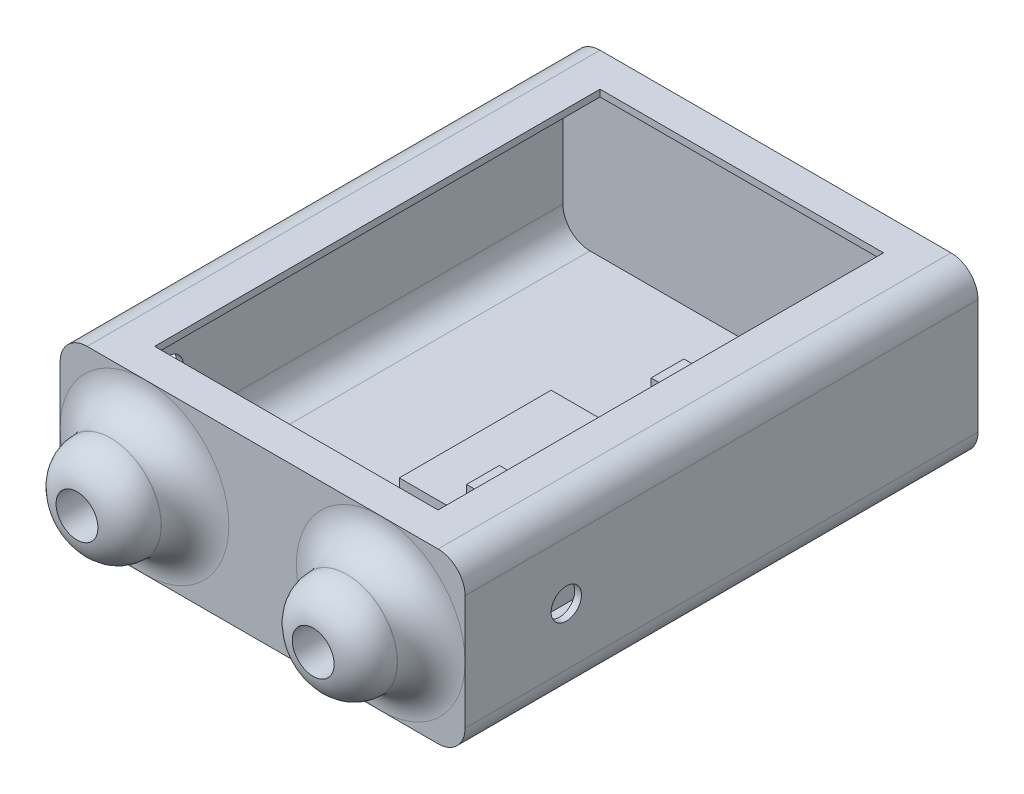
from build123d import *

# Parameters (mm, degrees)
SKETCH1_W           = 60
SKETCH1_H           = 25
BOSS_EXTRUDE1_DEPTH = 1
SKETCH2_W           = 60
SKETCH2_H           = 25
SKETCH2_W_2         = 58
SKETCH2_H_2         = 23
BOSS_EXTRUDE2_DEPTH = 75
FILLET2_R           = 4
SKETCH4_R           = 7.5
SKETCH4_R_2         = 3.1
BOSS_EXTRUDE3_DEPTH = 10
FILLET3_R           = 5
SKETCH18_R          = 2
CUT_EXTRUDE6_DEPTH  = 1
SKETCH5_R           = 2.25
CUT_EXTRUDE1_DEPTH  = 98.63324229
SKETCH10_W          = 22.476776695
SKETCH10_H          = 22.501776695
BOSS_EXTRUDE4_DEPTH = 6
SKETCH12_W          = 2.5
SKETCH12_H          = 4.858493649
BOSS_EXTRUDE5_DEPTH = 15
SKETCH13_R          = 1.35
CUT_EXTRUDE3_DEPTH  = 12
SKETCH19_W          = 42
SKETCH19_H          = 66
CUT_EXTRUDE7_DEPTH  = 1
BOSS_EXTRUDE7_DEPTH = 2.5


with BuildPart() as part:
    # Sketch1 → Boss-Extrude1 (new body)
    with BuildSketch(Plane.XY):
        Rectangle(SKETCH1_W, SKETCH1_H)
    extrude(amount=-BOSS_EXTRUDE1_DEPTH)

    # Sketch2 → Boss-Extrude2 (add)
    with BuildSketch(Plane(origin=(0, 0, -1), x_dir=(-1, 0, 0), z_dir=(0, 0, -1))):
        Rectangle(SKETCH2_W, SKETCH2_H)
        Rectangle(SKETCH2_W_2, SKETCH2_H_2, mode=Mode.SUBTRACT)
    extrude(amount=BOSS_EXTRUDE2_DEPTH)

    # Fillet2
    fillet2_edges = [part.edges().sort_by_distance(p)[0] for p in [
        (-29, 11.5, -38.5),
        (29, 11.5, -38.5),
        (29, -11.5, -38.5),
        (-29, -11.5, -38.5),
        (30, -12.5, -38),
        (-30, -12.5, -38),
        (-30, 12.5, -38),
        (30, 12.5, -38),
    ]]
    fillet(fillet2_edges, radius=FILLET2_R)

    # Sketch4 → Boss-Extrude3 (add)
    # profile 1 of 2: a face of its own
    with BuildSketch(Plane.XY):
        with Locations((-17.5, 0)):
            Circle(SKETCH4_R)
        with Locations((-17.5, 0)):
            Circle(SKETCH4_R_2, mode=Mode.SUBTRACT)
    # profile 2 of 2: a face of its own
    with BuildSketch(Plane.XY):
        with Locations((17.5, 0)):
            Circle(SKETCH4_R)
        with Locations((17.5, 0)):
            Circle(SKETCH4_R_2, mode=Mode.SUBTRACT)
    extrude(amount=BOSS_EXTRUDE3_DEPTH)

    # Fillet3
    # the kernel refuses this fillet: 5 mm, written as the material it adds along each edge
    with BuildSketch(Plane(origin=(17.5, 0, 0), x_dir=(1, 0, 0), z_dir=(0, -1, 0))) as fillet3_piece_1:
        with BuildLine():
            CenterArc((7.5 + FILLET3_R, FILLET3_R), FILLET3_R, 180, 90)
            Line((7.5, FILLET3_R), (7.5, 0))
            Line((7.5, 0), (7.5 + FILLET3_R, 0))
        make_face()
    revolve(axis=Axis((17.5, 0, 0), (0, 0, 1)))
    with BuildSketch(Plane(origin=(-17.5, 0, 0), x_dir=(1, 0, 0), z_dir=(0, -1, 0))) as fillet3_piece_2:
        with BuildLine():
            CenterArc((7.5 + FILLET3_R, FILLET3_R), FILLET3_R, 180, 90)
            Line((7.5, FILLET3_R), (7.5, 0))
            Line((7.5, 0), (7.5 + FILLET3_R, 0))
        make_face()
    revolve(axis=Axis((-17.5, 0, 0), (0, 0, 1)))
    # the kernel refuses this fillet: 5 mm, written as the material it takes off along each edge
    with BuildSketch(Plane(origin=(17.5, 0, 10), x_dir=(1, 0, 0), z_dir=(0, -1, 0))) as fillet3_2_piece_1:
        with BuildLine():
            CenterArc((2.5, -4.963869458), FILLET3_R, 0, 83.107897421)
            Line((3.1, 0), (7.5, 0))
            Line((7.5, 0), (7.5, -4.963869458))
        make_face()
    revolve(axis=Axis((17.5, 0, 10), (0, 0, 1)), mode=Mode.SUBTRACT)
    with BuildSketch(Plane(origin=(-17.5, 0, 10), x_dir=(1, 0, 0), z_dir=(0, -1, 0))) as fillet3_2_piece_2:
        with BuildLine():
            CenterArc((2.5, -4.963869458), FILLET3_R, 0, 83.107897421)
            Line((3.1, 0), (7.5, 0))
            Line((7.5, 0), (7.5, -4.963869458))
        make_face()
    revolve(axis=Axis((-17.5, 0, 10), (0, 0, 1)), mode=Mode.SUBTRACT)

    # Sketch18 → Cut-Extrude6 (cut)
    with BuildSketch(Plane.XY):
        with Locations((-17.5, 0)):
            Circle(SKETCH18_R)
        with Locations((17.5, 0)):
            Circle(SKETCH18_R)
    extrude(amount=-CUT_EXTRUDE6_DEPTH, mode=Mode.SUBTRACT)

    # Sketch5 → Cut-Extrude1 (cut, through all)
    with BuildSketch(Plane(origin=(30, 0, 0), x_dir=(0, 0, -1), z_dir=(1, 0, 0))):
        with Locations((15, 0)):
            Circle(SKETCH5_R)
    extrude(amount=-CUT_EXTRUDE1_DEPTH, mode=Mode.SUBTRACT)

    # Sketch10 → Boss-Extrude4 (add)
    with BuildSketch(Plane(origin=(0, -11.5, 0), x_dir=(1, 0, 0), z_dir=(0, 1, 0))):
        with Locations((7.241611652, 35.500888348)):
            Rectangle(SKETCH10_W, SKETCH10_H)
    extrude(amount=BOSS_EXTRUDE4_DEPTH)

    # Sketch12 → Boss-Extrude5 (add)
    with BuildSketch(Plane(origin=(0, -11.5, 0), x_dir=(1, 0, 0), z_dir=(0, 1, 0))):
        with Locations((12.08, 21.824246825)):
            Rectangle(SKETCH12_W, SKETCH12_H)
        with Locations((12.08, 49.165753176)):
            Rectangle(SKETCH12_W, SKETCH12_H)
    extrude(amount=BOSS_EXTRUDE5_DEPTH)

    # Sketch13 → Cut-Extrude3 (cut)
    with BuildSketch(Plane(origin=(13.33, 0, 0), x_dir=(0, 0, -1), z_dir=(1, 0, 0))):
        with Locations((21.82424682, 0)):
            Circle(SKETCH13_R)
        with Locations((49.165753171, 0)):
            Circle(SKETCH13_R)
    extrude(amount=-CUT_EXTRUDE3_DEPTH, mode=Mode.SUBTRACT)

    # Sketch19 → Cut-Extrude7 (cut)
    with BuildSketch(Plane(origin=(0, 12.5, 0), x_dir=(1, 0, 0), z_dir=(0, 1, 0))):
        with Locations((0, 38)):
            Rectangle(SKETCH19_W, SKETCH19_H)
    extrude(amount=-CUT_EXTRUDE7_DEPTH, mode=Mode.SUBTRACT)

    # Sketch20 → Boss-Extrude7 (add)
    with BuildSketch(Plane(origin=(0, 0, -76), x_dir=(-1, 0, 0), z_dir=(0, 0, -1))):
        with BuildLine():
            Line((-25, 11.5), (25, 11.5))
            ThreePointArc((25, 11.5), (27.828427125, 10.328427125), (29, 7.5))
            Line((29, 7.5), (29, -7.5))
            ThreePointArc((29, -7.5), (27.828427125, -10.328427125), (25, -11.5))
            Line((25, -11.5), (-25, -11.5))
            ThreePointArc((-25, -11.5), (-27.828427125, -10.328427125), (-29, -7.5))
            Line((-29, -7.5), (-29, 7.5))
            ThreePointArc((-29, 7.5), (-27.828427125, 10.328427125), (-25, 11.5))
        make_face()
    extrude(amount=-BOSS_EXTRUDE7_DEPTH)


solid = part.part
